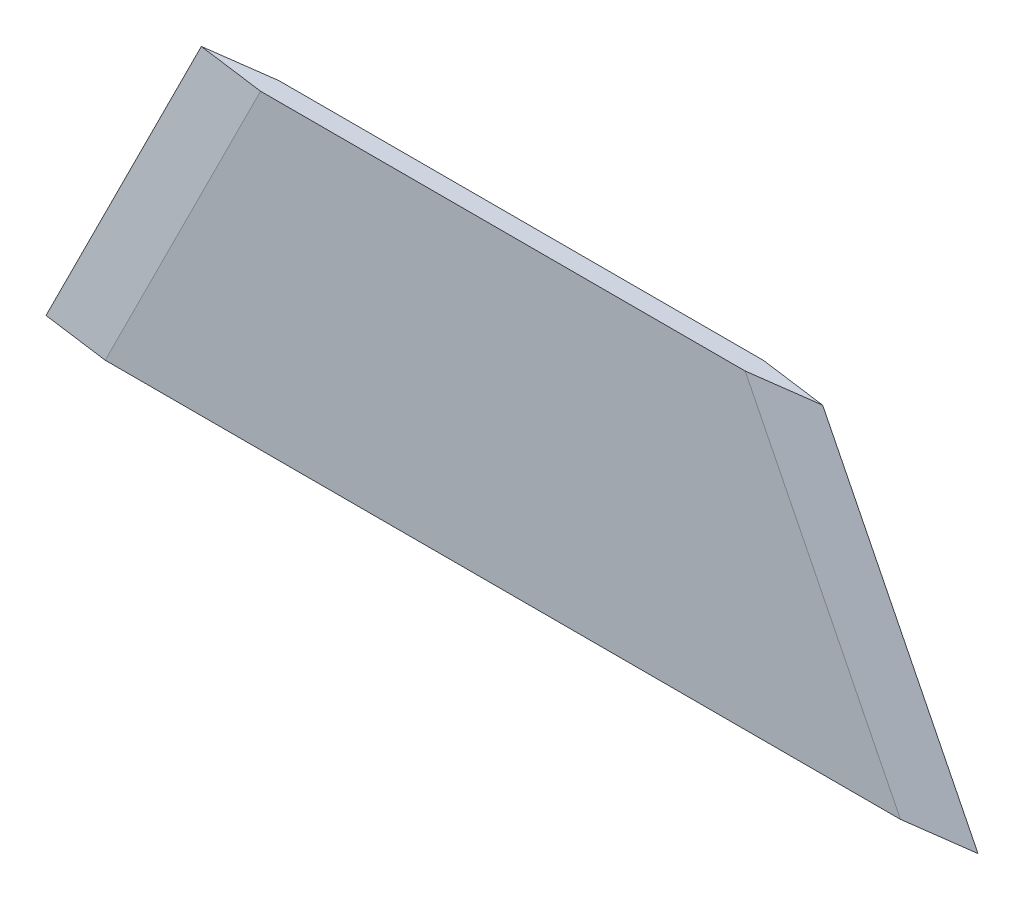
from build123d import *
from OCP.BRepFilletAPI import BRepFilletAPI_MakeChamfer

# Parameters (mm, degrees)
BOSS_EXTRUDE1_DEPTH = 1.4986
CHAMFER1_SIZE       = 1.4986
CHAMFER1_SIZE_2     = 10
CHAMFER2_SIZE       = 10
CHAMFER2_SIZE_2     = 1.4986


# Some blends are built 0.0001 mm under size
with BuildPart() as part:
    # Sketch1 → Boss-Extrude1 (new, symmetric)
    with BuildSketch(Plane.XY):
        Polygon((0, 0), (25.4, 50.8), (127, 50.8), (152.4, 0), align=None)
    extrude(amount=BOSS_EXTRUDE1_DEPTH, both=True)

    # Chamfer1
    # the kernel refuses this chamfer: 10, 1.4986 mm, written as the material it takes off along each edge
    with BuildSketch(Plane(origin=(-11.62280373, -23.24560746, -1.4986), x_dir=(-0.22013014518345764, 0.11006507259172885, 0.9692411459368031), z_dir=(0.4472135954999581, 0.8944271909999159, 0))) as chamfer1_piece_1:
        Polygon((CHAMFER1_SIZE * 0.969241145937, CHAMFER1_SIZE * 0.246112984264), (-CHAMFER1_SIZE_2 * 0.246112984264, CHAMFER1_SIZE_2 * 0.969241145937), (0, 0), align=None)
    extrude(amount=108.774885087, mode=Mode.SUBTRACT)
    with BuildSketch(Plane(origin=(-11.62280373, -23.24560746, 1.4986), x_dir=(-0.22013014518345764, 0.11006507259172885, -0.9692411459368031), z_dir=(0.4472135954999581, 0.8944271909999159, 0))) as chamfer1_piece_2:
        Polygon((CHAMFER1_SIZE * 0.969241145937, -CHAMFER1_SIZE * 0.246112984264), (-CHAMFER1_SIZE_2 * 0.246112984264, -CHAMFER1_SIZE_2 * 0.969241145937), (0, 0), align=None)
    extrude(amount=108.774885087, mode=Mode.SUBTRACT)

    # Chamfer2
    chamfer2_edges_1 = [part.edges().sort_by_distance(p)[0] for p in [
        (139.7, 25.4, -1.4986),
    ]]
    chamfer2_side_1 = [part.faces().sort_by_distance(p)[0] for p in [
        (139.673192228, 25.386596114, -1.4986),
    ]]
    chamfer2_edges_2 = [part.edges().sort_by_distance(p)[0] for p in [
        (139.7, 25.4, 1.4986),
    ]]
    chamfer2_side_2 = [part.faces().sort_by_distance(p)[0] for p in [
        (139.7, 25.4, 1.468628),
    ]]
    chamfer2 = BRepFilletAPI_MakeChamfer(part.part.solid().wrapped)
    for e in chamfer2_edges_1:
        chamfer2.Add(CHAMFER2_SIZE - 0.0001, CHAMFER2_SIZE_2 - 0.0001, e.wrapped, chamfer2_side_1[0].wrapped)
    for e in chamfer2_edges_2:
        chamfer2.Add(CHAMFER2_SIZE_2 - 0.0001, CHAMFER2_SIZE - 0.0001, e.wrapped, chamfer2_side_2[0].wrapped)
    add(Compound.cast(chamfer2.Shape()), mode=Mode.REPLACE)  # a hair under: the kernel refuses the full size


solid = part.part
